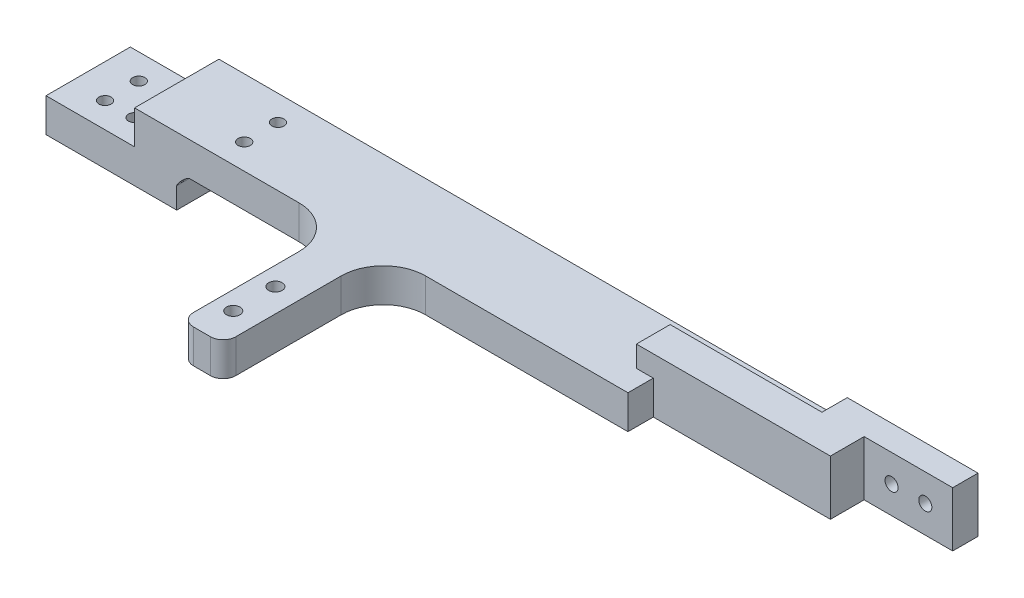
from build123d import *

# Parameters (mm, degrees)
SKETCH1_W                 = 300
SKETCH1_H                 = 20
BOSS_EXTRUDE1_DEPTH       = 8
SKETCH2_W                 = 34
SKETCH2_H                 = 8
BOSS_EXTRUDE2_DEPTH       = 9
SKETCH3_W                 = 34
SKETCH3_H                 = 8
BOSS_EXTRUDE3_DEPTH       = 9
SKETCH4_R                 = 1.45
CUT_EXTRUDE1_DEPTH        = 302.504560496
SKETCH5_W                 = 25
SKETCH5_H                 = 8
BOSS_EXTRUDE4_DEPTH       = 17
SKETCH6_W                 = 25
SKETCH6_H                 = 8
BOSS_EXTRUDE5_DEPTH       = 17
SKETCH12_W                = 8
SKETCH12_H                = 8
BOSS_EXTRUDE7_DEPTH       = 17
BOSS_EXTRUDE8_DEPTH       = 12
SKETCH15_R                = 1.6
CUT_EXTRUDE7_DEPTH        = 20
SKETCH16_W                = 20
SKETCH16_H                = 13
BOSS_EXTRUDE9_DEPTH       = 12
SKETCH17_R                = 1.6
CUT_EXTRUDE8_DEPTH        = 20
SKETCH18_W                = 20
SKETCH18_H                = 13
BOSS_EXTRUDE10_DEPTH      = 12
CUT_EXTRUDE9_START        = -20
SKETCH19_R                = 1.6
CUT_EXTRUDE9_DEPTH        = 20
SKETCH20_W                = 20
SKETCH20_H                = 13
BOSS_EXTRUDE11_DEPTH      = 12
CUT_EXTRUDE10_START       = -20
SKETCH21_R                = 1.6
CUT_EXTRUDE10_DEPTH       = 20
SKETCH22_W                = 10
SKETCH22_H                = 38
CUT_EXTRUDE11_DEPTH       = 306.0983448
SKETCH23_W                = 8
SKETCH23_H                = 18
CUT_EXTRUDE12_DEPTH       = 4
BOSS_EXTRUDE12_DEPTH      = 10
BOSS_EXTRUDE13_DEPTH      = 8
SKETCH26_W                = 8
SKETCH26_H                = 48
BOSS_EXTRUDE14_DEPTH      = 14
SKETCH27_W                = 8
SKETCH27_H                = 16
BOSS_EXTRUDE15_DEPTH      = 14
SKETCH28_W                = 8
SKETCH28_H                = 40
CUT_EXTRUDE13_DEPTH       = 14
SKETCH30_W                = 16
SKETCH30_H                = 14
BOSS_EXTRUDE16_DEPTH      = 9
SKETCH31_W                = 17
SKETCH31_H                = 8
CUT_EXTRUDE14_DEPTH       = 5
SKETCH32_W                = 16
SKETCH32_H                = 9
CUT_EXTRUDE15_DEPTH       = 9
CUT_EXTRUDE16_DEPTH       = 10
SKETCH34_W                = 7
SKETCH34_H                = 5
CUT_EXTRUDE17_DEPTH       = 5
SKETCH35_W                = 7
SKETCH35_H                = 5
BOSS_EXTRUDE17_DEPTH      = 5
SKETCH36_R                = 1.7
CUT_EXTRUDE18_DEPTH       = 307.014705529
SKETCH37_W                = 70
SKETCH37_H                = 8
BOSS_EXTRUDE18_DEPTH      = 5
SKETCH39_W                = 66
SKETCH39_H                = 6
CUT_EXTRUDE19_DEPTH       = 306.14258962
SKETCH40_W                = 20
SKETCH40_H                = 12
BOSS_EXTRUDE19_DEPTH      = 10
BOSS_EXTRUDE20_DEPTH      = 5
BOSS_EXTRUDE20_DEPTH_BACK = 5
SKETCH41_W                = 28
SKETCH41_H                = 12
SKETCH42_R                = 1.5
CUT_EXTRUDE20_DEPTH       = 15
SKETCH43_W                = 20
SKETCH43_H                = 12
BOSS_EXTRUDE21_DEPTH      = 10
BOSS_EXTRUDE22_DEPTH      = 5
BOSS_EXTRUDE22_DEPTH_BACK = 5
SKETCH44_W                = 28
SKETCH44_H                = 12
SKETCH45_R                = 1.5
CUT_EXTRUDE21_DEPTH       = 15
SKETCH46_W                = 20
SKETCH46_H                = 12
SKETCH46_W_2              = 19.974984355
BOSS_EXTRUDE23_DEPTH      = 10
BOSS_EXTRUDE24_DEPTH      = 5
BOSS_EXTRUDE24_DEPTH_BACK = 5
SKETCH47_W                = 28
SKETCH47_H                = 12
SKETCH47_W_2              = 28.025015645
CUT_EXTRUDE22_START       = -15
SKETCH48_R                = 1.5
CUT_EXTRUDE22_DEPTH       = 15
FILLET1_R                 = 5
FILLET2_R                 = 2.5
FILLET3_R                 = 3
FILLET4_R                 = 3
SKETCH49_R                = 1.45
CUT_EXTRUDE23_DEPTH       = 309.139578763
SKETCH50_W                = 97.606758594
SKETCH50_H                = 58.271300894
CUT_EXTRUDE24_DEPTH       = 40
SKETCH51_W                = 104.080215225
SKETCH51_H                = 68.777983442
CUT_EXTRUDE25_DEPTH       = 65
SKETCH54_W                = 8
SKETCH54_H                = 13
CUT_EXTRUDE26_DEPTH       = 21
SKETCH55_W                = 31
SKETCH55_H                = 6
BOSS_EXTRUDE26_DEPTH      = 5
SKETCH56_R                = 1.55
CUT_EXTRUDE27_DEPTH       = 239.765575408
SKETCH57_W                = 31
SKETCH57_H                = 20
BOSS_EXTRUDE27_DEPTH      = 8
SKETCH58_W                = 21
SKETCH58_H                = 20
CUT_EXTRUDE28_DEPTH       = 8
SKETCH59_R                = 1.45
CUT_EXTRUDE29_DEPTH       = 240.192391183
SKETCH60_W                = 10
SKETCH60_H                = 8
BOSS_EXTRUDE28_DEPTH      = 38
SKETCH61_R                = 1.6
CUT_EXTRUDE30_DEPTH       = 246.487270546
FILLET5_R                 = 10
FILLET6_SIZE              = 3
FILLET7_R                 = 3


with BuildPart() as part:
    # Sketch1 → Boss-Extrude1 (new body)
    with BuildSketch(Plane(origin=(0, 0, 0), x_dir=(1, 0, 0), z_dir=(0, 1, 0))):
        with Locations((150, -10)):
            Rectangle(SKETCH1_W, SKETCH1_H)
    extrude(amount=BOSS_EXTRUDE1_DEPTH)

    # Sketch2 → Boss-Extrude2 (add)
    with BuildSketch(Plane.XY.offset(20)):
        with Locations((17, 4)):
            Rectangle(SKETCH2_W, SKETCH2_H)
        with Locations((283, 4)):
            Rectangle(SKETCH2_W, SKETCH2_H)
    extrude(amount=BOSS_EXTRUDE2_DEPTH)

    # Sketch3 → Boss-Extrude3 (add)
    with BuildSketch(Plane(origin=(0, 0, 0), x_dir=(-1, 0, 0), z_dir=(0, 0, -1))):
        with Locations((-17, 4)):
            Rectangle(SKETCH3_W, SKETCH3_H)
        with Locations((-283, 4)):
            Rectangle(SKETCH3_W, SKETCH3_H)
    extrude(amount=BOSS_EXTRUDE3_DEPTH)

    # Sketch4 → Cut-Extrude1 (cut, through all)
    with BuildSketch(Plane(origin=(0, 8, 0), x_dir=(1, 0, 0), z_dir=(0, 1, 0))):
        with Locations(Location((4, 5, 0), (0, 0, 270))):
            Circle(SKETCH4_R)
        with Locations(Location((30, 5, 0), (0, 0, 270))):
            Circle(SKETCH4_R)
        with Locations(Location((30, -25, 0), (0, 0, 270))):
            Circle(SKETCH4_R)
        with Locations(Location((4, -25, 0), (0, 0, 270))):
            Circle(SKETCH4_R)
        with Locations(Location((296, -25, 0), (0, 0, 270))):
            Circle(SKETCH4_R)
        with Locations(Location((296, 5, 0), (0, 0, 270))):
            Circle(SKETCH4_R)
        with Locations(Location((270, -25, 0), (0, 0, 270))):
            Circle(SKETCH4_R)
        with Locations(Location((270, 5, 0), (0, 0, 270))):
            Circle(SKETCH4_R)
    extrude(amount=-CUT_EXTRUDE1_DEPTH, mode=Mode.SUBTRACT)

    # Sketch5 → Boss-Extrude4 (add)
    with BuildSketch(Plane.XY.offset(20)):
        with Locations((253.5, 4)):
            Rectangle(SKETCH5_W, SKETCH5_H)
    extrude(amount=BOSS_EXTRUDE4_DEPTH)

    # Sketch6 → Boss-Extrude5 (add)
    with BuildSketch(Plane(origin=(0, 0, 0), x_dir=(-1, 0, 0), z_dir=(0, 0, -1))):
        with Locations((-253.5, 4)):
            Rectangle(SKETCH6_W, SKETCH6_H)
    extrude(amount=BOSS_EXTRUDE5_DEPTH)

    # Sketch12 → Boss-Extrude7 (add)
    with BuildSketch(Plane.XY.offset(37)):
        with Locations((245, 4)):
            Rectangle(SKETCH12_W, SKETCH12_H)
    extrude(amount=BOSS_EXTRUDE7_DEPTH)

    # Sketch14 → Boss-Extrude8 (add)
    with BuildSketch(Plane.XY.offset(29)):
        Polygon((294.974984355, 8), (275, 8), (275, -4), (294.974984355, -5), align=None)
    extrude(amount=BOSS_EXTRUDE8_DEPTH)

    # Sketch15 → Cut-Extrude7 (cut)
    with BuildSketch(Plane(origin=(294.974984355, 0, 0), x_dir=(0, 0, -1), z_dir=(1, 0, 0))):
        with Locations((-35, 0)):
            Circle(SKETCH15_R)
    extrude(amount=-CUT_EXTRUDE7_DEPTH, mode=Mode.SUBTRACT)

    # Sketch16 → Boss-Extrude9 (add)
    with BuildSketch(Plane(origin=(0, 0, -9), x_dir=(-1, 0, 0), z_dir=(0, 0, -1))):
        with Locations((-285, 1.5)):
            Rectangle(SKETCH16_W, SKETCH16_H)
    extrude(amount=BOSS_EXTRUDE9_DEPTH)

    # Sketch17 → Cut-Extrude8 (cut)
    with BuildSketch(Plane(origin=(295, 0, 0), x_dir=(0, 0, -1), z_dir=(1, 0, 0))):
        with Locations((15, 0)):
            Circle(SKETCH17_R)
    extrude(amount=-CUT_EXTRUDE8_DEPTH, mode=Mode.SUBTRACT)

    # Sketch18 → Boss-Extrude10 (add)
    with BuildSketch(Plane(origin=(0, 0, -9), x_dir=(-1, 0, 0), z_dir=(0, 0, -1))):
        with Locations((-15, 1.5)):
            Rectangle(SKETCH18_W, SKETCH18_H)
    extrude(amount=BOSS_EXTRUDE10_DEPTH)

    # Sketch19 → Cut-Extrude9 (cut)
    with BuildSketch(Plane.ZY.offset(-5).offset(CUT_EXTRUDE9_START)):
        with Locations(Location((-15, 0, 0), (0, 0, 180))):
            Circle(SKETCH19_R)
    extrude(amount=CUT_EXTRUDE9_DEPTH, mode=Mode.SUBTRACT)

    # Sketch20 → Boss-Extrude11 (add)
    with BuildSketch(Plane.XY.offset(29)):
        with Locations((15, 1.5)):
            Rectangle(SKETCH20_W, SKETCH20_H)
    extrude(amount=BOSS_EXTRUDE11_DEPTH)

    # Sketch21 → Cut-Extrude10 (cut)
    with BuildSketch(Plane.ZY.offset(-5).offset(CUT_EXTRUDE10_START)):
        with Locations(Location((35, 0, 0), (0, 0, 180))):
            Circle(SKETCH21_R)
    extrude(amount=CUT_EXTRUDE10_DEPTH, mode=Mode.SUBTRACT)

    # Sketch22 → Cut-Extrude11 (cut, through all)
    with BuildSketch(Plane(origin=(0, 8, 0), x_dir=(1, 0, 0), z_dir=(0, 1, 0))):
        with Locations((254, -10)):
            Rectangle(SKETCH22_W, SKETCH22_H)
    extrude(amount=-CUT_EXTRUDE11_DEPTH, mode=Mode.SUBTRACT)

    # Sketch23 → Cut-Extrude12 (cut)
    with BuildSketch(Plane(origin=(0, 0, 0), x_dir=(-1, 0, 0), z_dir=(0, -1, 0))):
        with Locations((-263, -10)):
            Rectangle(SKETCH23_W, SKETCH23_H)
    extrude(amount=-CUT_EXTRUDE12_DEPTH, mode=Mode.SUBTRACT)

    # Sketch24 → Boss-Extrude12 (add)
    with BuildSketch(Plane.ZY.offset(-259)):
        Polygon((-9, 0), (-9, 8), (-1, 8), align=None)
        Polygon((29, 0), (29, 8), (21, 8), align=None)
    extrude(amount=BOSS_EXTRUDE12_DEPTH)

    # Sketch25 → Boss-Extrude13 (add)
    with BuildSketch(Plane.ZY.offset(-267)):
        Polygon((19, 0), (19, 4), (15, 4), align=None)
        Polygon((1, 4), (5, 4), (1, 0), align=None)
    extrude(amount=BOSS_EXTRUDE13_DEPTH)

    # Sketch26 → Boss-Extrude14 (add)
    with BuildSketch(Plane(origin=(0, 8, 0), x_dir=(1, 0, 0), z_dir=(0, 1, 0))):
        with Locations((245, -30)):
            Rectangle(SKETCH26_W, SKETCH26_H)
    extrude(amount=BOSS_EXTRUDE14_DEPTH)

    # Sketch27 → Boss-Extrude15 (add)
    with BuildSketch(Plane(origin=(0, 8, 0), x_dir=(1, 0, 0), z_dir=(0, 1, 0))):
        with Locations((253, -29)):
            Rectangle(SKETCH27_W, SKETCH27_H)
    extrude(amount=BOSS_EXTRUDE15_DEPTH)

    # Sketch28 → Cut-Extrude13 (cut)
    with BuildSketch(Plane.XZ):
        with Locations((245, 34)):
            Rectangle(SKETCH28_W, SKETCH28_H)
    extrude(amount=-CUT_EXTRUDE13_DEPTH, mode=Mode.SUBTRACT)

    # Sketch30 → Boss-Extrude16 (add)
    with BuildSketch(Plane(origin=(257, 0, 0), x_dir=(0, 0, -1), z_dir=(1, 0, 0))):
        with Locations((-29, 15)):
            Rectangle(SKETCH30_W, SKETCH30_H)
    extrude(amount=BOSS_EXTRUDE16_DEPTH)

    # Sketch31 → Cut-Extrude14 (cut)
    with BuildSketch(Plane(origin=(0, 0, 0), x_dir=(-1, 0, 0), z_dir=(0, -1, 0))):
        with Locations((-257.5, -33)):
            Rectangle(SKETCH31_W, SKETCH31_H)
    extrude(amount=-CUT_EXTRUDE14_DEPTH, mode=Mode.SUBTRACT)

    # Sketch32 → Cut-Extrude15 (cut)
    with BuildSketch(Plane(origin=(266, 0, 0), x_dir=(0, 0, -1), z_dir=(1, 0, 0))):
        with Locations((-29, 17.5)):
            Rectangle(SKETCH32_W, SKETCH32_H)
    extrude(amount=-CUT_EXTRUDE15_DEPTH, mode=Mode.SUBTRACT)

    # Sketch33 → Cut-Extrude16 (cut)
    with BuildSketch(Plane.ZY.offset(-249)):
        Polygon((29, 5), (24, 5), (29, 0), align=None)
    extrude(amount=-CUT_EXTRUDE16_DEPTH, mode=Mode.SUBTRACT)

    # Sketch34 → Cut-Extrude17 (cut)
    with BuildSketch(Plane.XY.offset(29)):
        with Locations((262.5, 2.5)):
            Rectangle(SKETCH34_W, SKETCH34_H)
    extrude(amount=-CUT_EXTRUDE17_DEPTH, mode=Mode.SUBTRACT)

    # Sketch35 → Boss-Extrude17 (add)
    with BuildSketch(Plane(origin=(0, 0, 21), x_dir=(-1, 0, 0), z_dir=(0, 0, -1))):
        with Locations((-262.5, 10.5)):
            Rectangle(SKETCH35_W, SKETCH35_H)
    extrude(amount=BOSS_EXTRUDE17_DEPTH)

    # Sketch36 → Cut-Extrude18 (cut, through all)
    with BuildSketch(Plane(origin=(0, 22, 0), x_dir=(1, 0, 0), z_dir=(0, 1, 0))):
        with Locations(Location((245, -50, 0), (0, 0, 270))):
            Circle(SKETCH36_R)
        with Locations(Location((245, -18, 0), (0, 0, 270))):
            Circle(SKETCH36_R)
    extrude(amount=-CUT_EXTRUDE18_DEPTH, mode=Mode.SUBTRACT)

    # Sketch37 → Boss-Extrude18 (add)
    with BuildSketch(Plane(origin=(0, 8, 0), x_dir=(1, 0, 0), z_dir=(0, 1, 0))):
        with Locations((206, -10)):
            Rectangle(SKETCH37_W, SKETCH37_H)
    extrude(amount=BOSS_EXTRUDE18_DEPTH)

    # Sketch39 → Cut-Extrude19 (cut, through all)
    with BuildSketch(Plane(origin=(0, 8, 0), x_dir=(1, 0, 0), z_dir=(0, 1, 0))):
        with Locations((208, -17)):
            Rectangle(SKETCH39_W, SKETCH39_H)
    extrude(amount=-CUT_EXTRUDE19_DEPTH, mode=Mode.SUBTRACT)

    # Sketch40 → Boss-Extrude19 (add)
    with BuildSketch(Plane(origin=(0, 8, 0), x_dir=(1, 0, 0), z_dir=(0, 1, 0))):
        with Locations((15, 15)):
            Rectangle(SKETCH40_W, SKETCH40_H)
    extrude(amount=BOSS_EXTRUDE19_DEPTH)

    # Sketch41 → Boss-Extrude20 (add, two sides: drawn at the far end of the back side and taken through both)
    with BuildSketch(Plane(origin=(0, 18, 0), x_dir=(1, 0, 0), z_dir=(0, 1, 0)).offset(-BOSS_EXTRUDE20_DEPTH_BACK)):
        with Locations((11, 15)):
            Rectangle(SKETCH41_W, SKETCH41_H)
    extrude(amount=BOSS_EXTRUDE20_DEPTH + BOSS_EXTRUDE20_DEPTH_BACK)

    # Sketch42 → Cut-Extrude20 (cut)
    with BuildSketch(Plane.ZY.offset(3)):
        with Locations((-14, 18)):
            Circle(SKETCH42_R)
    extrude(amount=-CUT_EXTRUDE20_DEPTH, mode=Mode.SUBTRACT)

    # Sketch43 → Boss-Extrude21 (add)
    with BuildSketch(Plane(origin=(0, 8, 0), x_dir=(1, 0, 0), z_dir=(0, 1, 0))):
        with Locations((15, -35)):
            Rectangle(SKETCH43_W, SKETCH43_H)
    extrude(amount=BOSS_EXTRUDE21_DEPTH)

    # Sketch44 → Boss-Extrude22 (add, two sides: drawn at the far end of the back side and taken through both)
    with BuildSketch(Plane(origin=(0, 18, 0), x_dir=(1, 0, 0), z_dir=(0, 1, 0)).offset(-BOSS_EXTRUDE22_DEPTH_BACK)):
        with Locations((11, -35)):
            Rectangle(SKETCH44_W, SKETCH44_H)
    extrude(amount=BOSS_EXTRUDE22_DEPTH + BOSS_EXTRUDE22_DEPTH_BACK)

    # Sketch45 → Cut-Extrude21 (cut)
    with BuildSketch(Plane.ZY.offset(3)):
        with Locations((36, 18)):
            Circle(SKETCH45_R)
    extrude(amount=-CUT_EXTRUDE21_DEPTH, mode=Mode.SUBTRACT)

    # Sketch46 → Boss-Extrude23 (add)
    with BuildSketch(Plane(origin=(0, 8, 0), x_dir=(1, 0, 0), z_dir=(0, 1, 0))):
        with Locations((285, 15)):
            Rectangle(SKETCH46_W, SKETCH46_H)
        with Locations((284.987492178, -35)):
            Rectangle(SKETCH46_W_2, SKETCH46_H)
    extrude(amount=BOSS_EXTRUDE23_DEPTH)

    # Sketch47 → Boss-Extrude24 (add, two sides: drawn at the far end of the back side and taken through both)
    with BuildSketch(Plane(origin=(0, 18, 0), x_dir=(1, 0, 0), z_dir=(0, 1, 0)).offset(-BOSS_EXTRUDE24_DEPTH_BACK)):
        with Locations((289, 15)):
            Rectangle(SKETCH47_W, SKETCH47_H)
        with Locations((288.987492178, -35)):
            Rectangle(SKETCH47_W_2, SKETCH47_H)
    extrude(amount=BOSS_EXTRUDE24_DEPTH + BOSS_EXTRUDE24_DEPTH_BACK)

    # Sketch48 → Cut-Extrude22 (cut)
    with BuildSketch(Plane(origin=(303, 0, 0), x_dir=(0, 0, -1), z_dir=(1, 0, 0)).offset(CUT_EXTRUDE22_START)):
        with Locations((16, 18)):
            Circle(SKETCH48_R)
        with Locations(Location((-36, 18, 0), (0, 0, 180))):
            Circle(SKETCH48_R)
    extrude(amount=CUT_EXTRUDE22_DEPTH, mode=Mode.SUBTRACT)

    # Fillet1
    fillet1_edges = [part.edges().sort_by_distance(p)[0] for p in [
        (294.974984355, 13, 35),
        (295, 13, -15),
        (5, 13, 35),
        (5, 13, -15),
    ]]
    fillet(fillet1_edges, radius=FILLET1_R)

    # Fillet2
    # the kernel refuses this fillet: 2.5 mm, written as the material it adds along each edge
    with BuildSketch(Plane(origin=(-1.25, 8, -9), x_dir=(0, 1, 0), z_dir=(1, 0, 0))) as fillet2_piece_1_section:
        with BuildLine():
            CenterArc((FILLET2_R, FILLET2_R), FILLET2_R, 180, 90)
            Line((0, FILLET2_R), (0, 0))
            Line((0, 0), (FILLET2_R, 0))
        make_face()
    fillet2_piece_1 = extrude(amount=26.25, mode=Mode.PRIVATE)
    fillet2_piece_1 = fillet2_piece_1 - Plane(origin=(0, 8, -9), x_dir=(1, 0, 0), z_dir=(0, 0, -1)) * Cylinder(5, 63, mode=Mode.PRIVATE)
    add(fillet2_piece_1)
    with BuildSketch(Plane(origin=(25, 8, 29), x_dir=(0, 0, -1), z_dir=(-1, 0, 0))) as fillet2_piece_2_section:
        with BuildLine():
            CenterArc((FILLET2_R, -FILLET2_R), FILLET2_R, 90, 90)
            Line((0, -FILLET2_R), (0, 0))
            Line((0, 0), (FILLET2_R, 0))
        make_face()
    fillet2_piece_2 = extrude(amount=26.25, mode=Mode.PRIVATE)
    fillet2_piece_2 = fillet2_piece_2 - Plane(origin=(0, 8, 29), x_dir=(1, 0, 0), z_dir=(0, 0, 1)) * Cylinder(5, 63, mode=Mode.PRIVATE)
    add(fillet2_piece_2)
    with BuildSketch(Plane(origin=(301.25, 8, -9), x_dir=(0, 0, 1), z_dir=(-1, 0, 0))) as fillet2_piece_3_section:
        with BuildLine():
            CenterArc((FILLET2_R, FILLET2_R), FILLET2_R, 180, 90)
            Line((0, FILLET2_R), (0, 0))
            Line((0, 0), (FILLET2_R, 0))
        make_face()
    fillet2_piece_3 = extrude(amount=26.25, mode=Mode.PRIVATE)
    fillet2_piece_3 = fillet2_piece_3 - Plane(origin=(300, 8, -9), x_dir=(-1, 0, 0), z_dir=(0, 0, -1)) * Cylinder(5, 63, mode=Mode.PRIVATE)
    add(fillet2_piece_3)
    with BuildSketch(Plane(origin=(275, 8, 29), x_dir=(0, 0, -1), z_dir=(1, 0, 0))) as fillet2_piece_4_section:
        with BuildLine():
            CenterArc((FILLET2_R, FILLET2_R), FILLET2_R, 180, 90)
            Line((0, FILLET2_R), (0, 0))
            Line((0, 0), (FILLET2_R, 0))
        make_face()
    fillet2_piece_4 = extrude(amount=26.224984355, mode=Mode.PRIVATE)
    fillet2_piece_4 = fillet2_piece_4 - Plane(origin=(299.974984355, 8, 29), x_dir=(-1, 0, 0), z_dir=(0, 0, 1)) * Cylinder(5, 63, mode=Mode.PRIVATE)
    add(fillet2_piece_4)

    # Fillet3
    fillet3_edges = [part.edges().sort_by_distance(p)[0] for p in [
        (284.987492178, -4.5, 29),
        (284.987492178, -4.5, 41),
        (285, -5, -9),
        (285, -5, -21),
        (15, -5, -9),
        (15, -5, -21),
        (15, -5, 29),
        (15, -5, 41),
    ]]
    fillet(fillet3_edges, radius=FILLET3_R)

    # Fillet4
    fillet4_edges = [part.edges().sort_by_distance(p)[0] for p in [
        (11, 23, -21),
        (11, 23, -9),
        (11, 23, 41),
        (11, 23, 29),
        (289, 23, -9),
        (289, 23, -21),
        (288.987492178, 23, 41),
        (288.987492178, 23, 29),
    ]]
    fillet(fillet4_edges, radius=FILLET4_R)

    # Sketch49 → Cut-Extrude23 (cut, through all)
    with BuildSketch(Plane(origin=(0, 8, 0), x_dir=(1, 0, 0), z_dir=(0, 1, 0))):
        with Locations(Location((78, -6, 0), (0, 0, 270))):
            Circle(SKETCH49_R)
        with Locations(Location((78, -14, 0), (0, 0, 270))):
            Circle(SKETCH49_R)
    extrude(amount=-CUT_EXTRUDE23_DEPTH, mode=Mode.SUBTRACT)

    # Sketch50 → Cut-Extrude24 (cut)
    with BuildSketch(Plane.ZY.offset(3)):
        with Locations((13.990606819, 7.473892718)):
            Rectangle(SKETCH50_W, SKETCH50_H)
    extrude(amount=-CUT_EXTRUDE24_DEPTH, mode=Mode.SUBTRACT)

    # Sketch51 → Cut-Extrude25 (cut)
    with BuildSketch(Plane(origin=(303, 0, 0), x_dir=(0, 0, -1), z_dir=(1, 0, 0))):
        with Locations((-18.453232298, 2.421236934)):
            Rectangle(SKETCH51_W, SKETCH51_H)
    extrude(amount=-CUT_EXTRUDE25_DEPTH, mode=Mode.SUBTRACT)

    # Sketch54 → Cut-Extrude26 (cut)
    with BuildSketch(Plane(origin=(238, 0, 0), x_dir=(0, 0, -1), z_dir=(1, 0, 0))):
        with Locations((-10, 6.5)):
            Rectangle(SKETCH54_W, SKETCH54_H)
    extrude(amount=-CUT_EXTRUDE26_DEPTH, mode=Mode.SUBTRACT)

    # Sketch55 → Boss-Extrude26 (add)
    with BuildSketch(Plane(origin=(0, 8, 0), x_dir=(1, 0, 0), z_dir=(0, 1, 0))):
        with Locations((222.5, -3)):
            Rectangle(SKETCH55_W, SKETCH55_H)
    extrude(amount=BOSS_EXTRUDE26_DEPTH)

    # Sketch56 → Cut-Extrude27 (cut, through all)
    with BuildSketch(Plane.XY.offset(6)):
        with Locations((231.5, 6.5)):
            Circle(SKETCH56_R)
        with Locations((223.5, 6.5)):
            Circle(SKETCH56_R)
    extrude(amount=-CUT_EXTRUDE27_DEPTH, mode=Mode.SUBTRACT)

    # Sketch57 → Boss-Extrude27 (add)
    with BuildSketch(Plane(origin=(0, 0, 0), x_dir=(-1, 0, 0), z_dir=(0, -1, 0))):
        with Locations((-52.5, -10)):
            Rectangle(SKETCH57_W, SKETCH57_H)
    extrude(amount=BOSS_EXTRUDE27_DEPTH)

    # Sketch58 → Cut-Extrude28 (cut)
    with BuildSketch(Plane(origin=(0, 8, 0), x_dir=(1, 0, 0), z_dir=(0, 1, 0))):
        with Locations((47.5, -10)):
            Rectangle(SKETCH58_W, SKETCH58_H)
    extrude(amount=-CUT_EXTRUDE28_DEPTH, mode=Mode.SUBTRACT)

    # Sketch59 → Cut-Extrude29 (cut, through all)
    with BuildSketch(Plane(origin=(0, 0, 0), x_dir=(1, 0, 0), z_dir=(0, 1, 0))):
        with Locations(Location((52, -6, 0), (0, 0, 270))):
            Circle(SKETCH59_R)
        with Locations(Location((45, -6, 0), (0, 0, 270))):
            Circle(SKETCH59_R)
        with Locations(Location((45, -14, 0), (0, 0, 270))):
            Circle(SKETCH59_R)
        with Locations(Location((52, -14, 0), (0, 0, 270))):
            Circle(SKETCH59_R)
    extrude(amount=-CUT_EXTRUDE29_DEPTH, mode=Mode.SUBTRACT)

    # Sketch60 → Boss-Extrude28 (add)
    with BuildSketch(Plane.XY.offset(20)):
        with Locations((112, 4)):
            Rectangle(SKETCH60_W, SKETCH60_H)
    extrude(amount=BOSS_EXTRUDE28_DEPTH)

    # Sketch61 → Cut-Extrude30 (cut, through all)
    with BuildSketch(Plane(origin=(0, 8, 0), x_dir=(1, 0, 0), z_dir=(0, 1, 0))):
        with Locations(Location((111.4, -50, 0), (0, 0, 270))):
            Circle(SKETCH61_R)
        with Locations(Location((111.4, -40, 0), (0, 0, 270))):
            Circle(SKETCH61_R)
    extrude(amount=-CUT_EXTRUDE30_DEPTH, mode=Mode.SUBTRACT)

    # Fillet5
    fillet5_edges = [part.edges().sort_by_distance(p)[0] for p in [
        (107, 4, 20),
        (117, 4, 20),
    ]]
    fillet(fillet5_edges, radius=FILLET5_R)

    # Fillet6
    # a fillet whose section is not a circle: 3 mm, written as the material it adds along each edge
    with BuildSketch(Plane(origin=(68, 0, 20), x_dir=(1, 0, 0), z_dir=(0, 0, -1))) as fillet6_piece_1:
        with BuildLine():
            Bezier((FILLET6_SIZE, 0), (0, 0), (0, FILLET6_SIZE), weights=[1, 0.176470588, 1])
            Line((0, FILLET6_SIZE), (0, 0))
            Line((0, 0), (FILLET6_SIZE, 0))
        make_face()
    extrude(amount=20)

    # Fillet7
    fillet7_edges = [part.edges().sort_by_distance(p)[0] for p in [
        (107, 4, 58),
        (117, 4, 58),
    ]]
    fillet(fillet7_edges, radius=FILLET7_R)


solid = part.part
